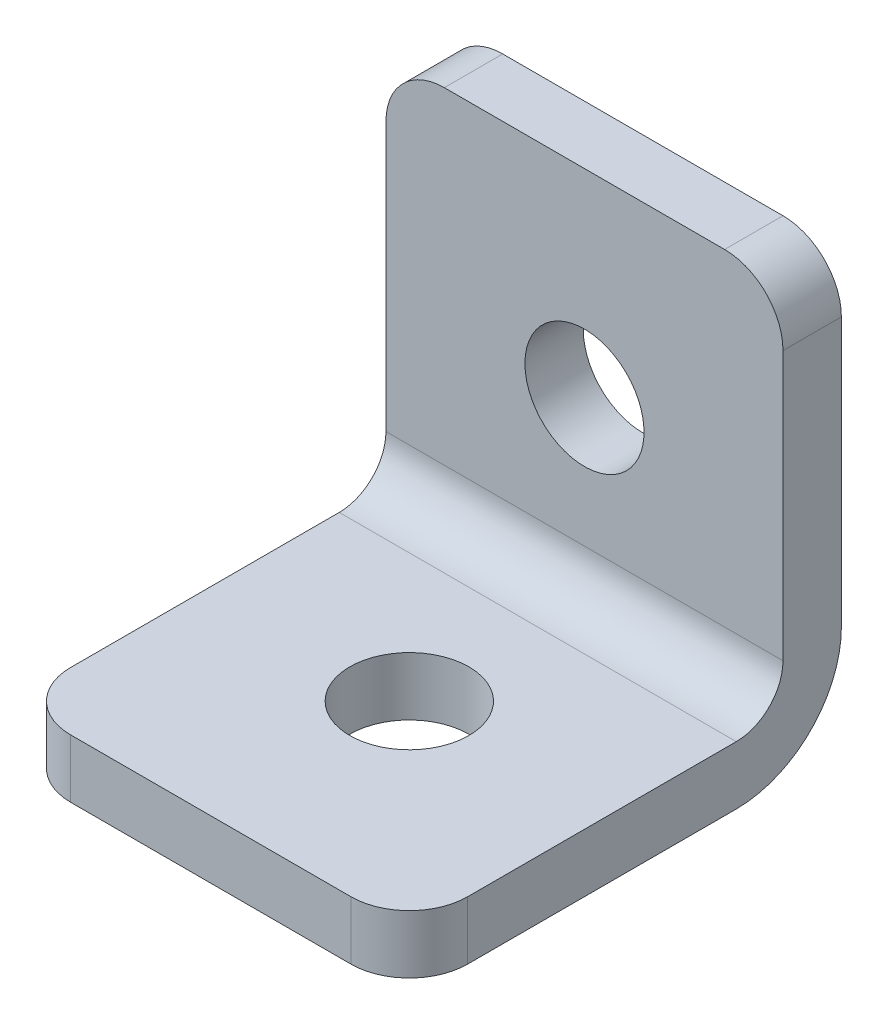
from build123d import *

# Parameters (mm, degrees)
BASE_DEPTH  = 17
FILLET_2_R  = 2.5
SKETCH_2_R  = 2.55
HOLE1_DEPTH = 17
SKETCH_3_R  = 2.55
HOLE2_DEPTH = 17


with BuildPart() as part:
    # Эскиз1 → Base (new body)
    with BuildSketch(Plane(origin=(0, 0, 0), x_dir=(0, 0, -1), z_dir=(1, 0, 0))):
        with BuildLine():
            Line((14, 2.5), (0, 2.5))
            Line((0, 2.5), (0, 0))
            Line((0, 0), (14, 0))
            ThreePointArc((14, 0), (17.181980515, 1.318019485), (18.5, 4.5))
            Line((18.5, 4.5), (18.5, 18.5))
            Line((18.5, 18.5), (16, 18.5))
            Line((16, 18.5), (16, 4.5))
            ThreePointArc((16, 4.5), (15.414213562, 3.085786438), (14, 2.5))
        make_face()
    extrude(amount=BASE_DEPTH)

    # Fillet 2
    fillet_2_edges = [part.edges().sort_by_distance(p)[0] for p in [
        (0, 18.5, -17.25),
        (17, 18.5, -17.25),
        (17, 1.25, 0),
        (0, 1.25, 0),
    ]]
    fillet(fillet_2_edges, radius=FILLET_2_R)

    # Эскиз2 → Hole1 (cut)
    with BuildSketch(Plane.XZ):
        with Locations((8.5, -8.5)):
            Circle(SKETCH_2_R)
    extrude(amount=-HOLE1_DEPTH, mode=Mode.SUBTRACT)

    # Эскиз3 → Hole2 (cut)
    with BuildSketch(Plane(origin=(0, 0, -18.5), x_dir=(-1, 0, 0), z_dir=(0, 0, -1))):
        with Locations((-8.5, 10)):
            Circle(SKETCH_3_R)
    extrude(amount=-HOLE2_DEPTH, mode=Mode.SUBTRACT)


solid = part.part
